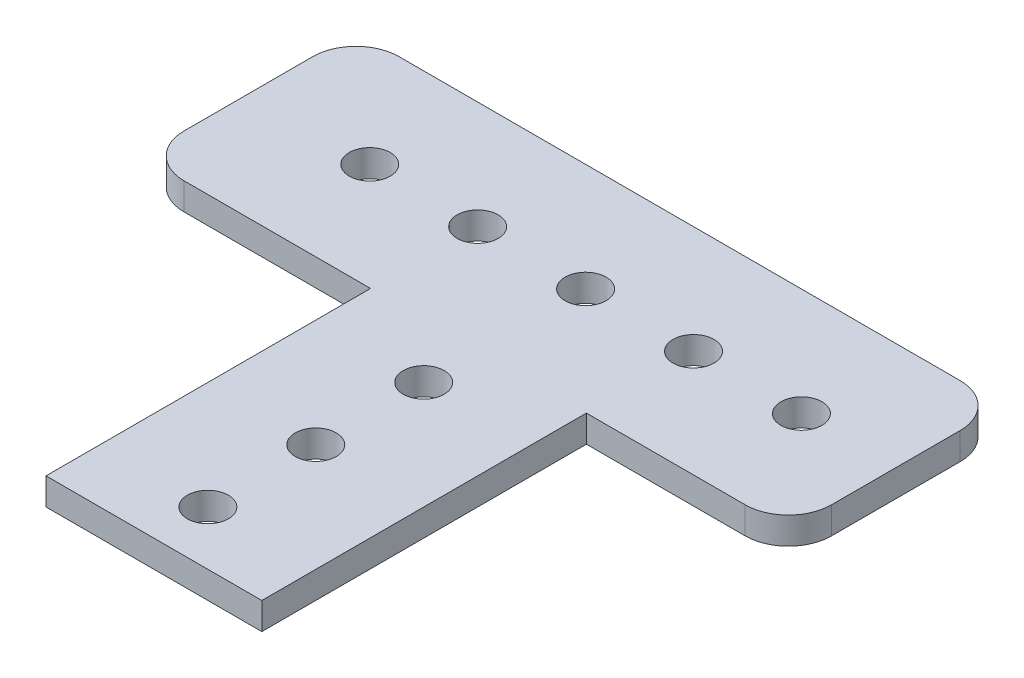
from build123d import *

# Parameters (mm, degrees)
BOSS_EXTRUDE1_DEPTH = 3.175
FILLET1_R           = 5.08
SKETCH2_R           = 2.413
SKETCH2_W           = 25.4
SKETCH2_H           = 12.7
CUT_EXTRUDE1_DEPTH  = 91.742852002


with BuildPart() as part:
    # Sketch1 → Boss-Extrude1 (new body)
    with BuildSketch(Plane(origin=(0, 0, 0), x_dir=(1, 0, 0), z_dir=(0, 1, 0))):
        Polygon((25.4, 50.895849057), (49.170566038, 50.895849057), (49.170566038, 76.2), (-27.029433962, 76.2), (-27.029433962, 50.895849057), (0, 50.895849057), (0, 0), (25.4, 0), align=None)
    extrude(amount=BOSS_EXTRUDE1_DEPTH)

    # Fillet1
    fillet1_edges = [part.edges().sort_by_distance(p)[0] for p in [
        (-27.029433962, 1.5875, -50.895849057),
        (0, 1.5875, 0),
        (25.4, 1.5875, 0),
        (49.170566038, 1.5875, -50.895849057),
        (49.170566038, 1.5875, -76.2),
        (-27.029433962, 1.5875, -76.2),
    ]]
    fillet(fillet1_edges, radius=FILLET1_R)

    # Sketch2 → Cut-Extrude1 (cut, through all)
    with BuildSketch(Plane(origin=(0, 3.175, 0), x_dir=(1, 0, 0), z_dir=(0, 1, 0))):
        with Locations((12.7, 19.05)):
            Circle(SKETCH2_R)
        with Locations((12.7, 31.75)):
            Circle(SKETCH2_R)
        with Locations((12.7, 44.45)):
            Circle(SKETCH2_R)
        with Locations((-12.698753962, 63.5)):
            Circle(SKETCH2_R)
        with Locations((0.001246038, 63.5)):
            Circle(SKETCH2_R)
        with Locations((12.701246038, 63.5)):
            Circle(SKETCH2_R)
        with Locations((25.401246038, 63.5)):
            Circle(SKETCH2_R)
        with Locations((38.101246038, 63.5)):
            Circle(SKETCH2_R)
        with Locations((12.7, 6.35)):
            Rectangle(SKETCH2_W, SKETCH2_H)
    extrude(amount=-CUT_EXTRUDE1_DEPTH, mode=Mode.SUBTRACT)


solid = part.part
